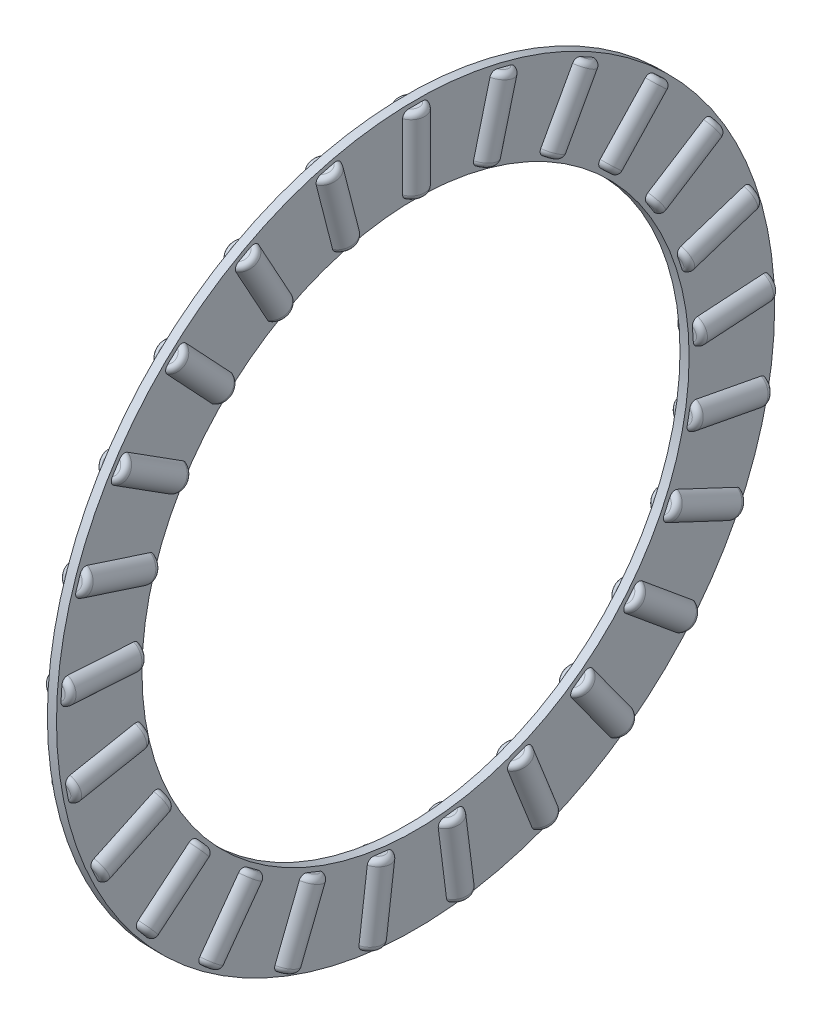
from build123d import *

# Parameters (mm, degrees)
CAGSPISKE_W           = 1.333333334
CAGSPISKE_H           = 12.5
ROLLERSDETAILED_COUNT = 25
ROLLERSDETAILED_ANGLE = 345.6


with BuildPart() as part:
    # CagSpiSke → CageSpine (revolve)
    with BuildSketch(Plane.XY):
        with Locations((0, 46.25)):
            Rectangle(CAGSPISKE_W, CAGSPISKE_H)
    revolve(axis=Axis((-34.925, 0, 0), (1, 0, 0)))

    # RolDetSke → RollerDetailed (revolve)
    with BuildSketch(Plane.XY):
        with BuildLine():
            Line((0, 51.875), (1.2, 51.875))
            ThreePointArc((1.2, 51.875), (1.765685425, 51.640685425), (2, 51.075))
            Line((2, 51.075), (2, 41.425))
            ThreePointArc((2, 41.425), (1.765685425, 40.859314575), (1.2, 40.625))
            Line((1.2, 40.625), (0, 40.625))
            Line((0, 40.625), (0, 51.875))
        make_face()
    rollerdetailed = revolve(axis=Axis((0, 33.02, 0), (0, 1, 0)))

    # RollersDetailed: RollerDetailed ×25 about axis
    rollersdetailed_axis = Axis((-50, 0, 0), (1, 0, 0))
    for i in range(1, ROLLERSDETAILED_COUNT):
        add(rollerdetailed.rotate(rollersdetailed_axis, i * ROLLERSDETAILED_ANGLE / (ROLLERSDETAILED_COUNT - 1)))


solid = part.part
